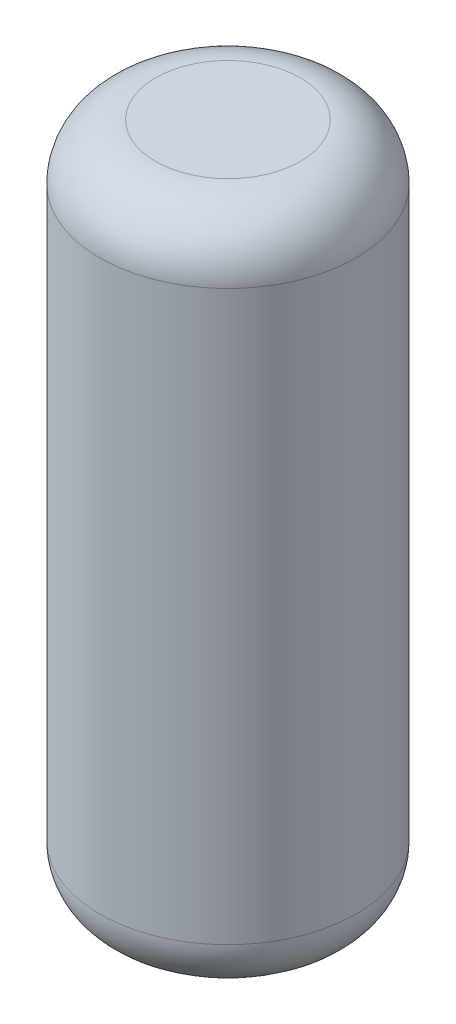
from build123d import *

# Parameters (mm, degrees)
SKETCH3_R           = 12.7
BOSS_EXTRUDE1_DEPTH = 19.05
SHELL1_T            = -2.54
BOSS_EXTRUDE2_START = -19.05
SKETCH6_R           = 12.7
BOSS_EXTRUDE2_DEPTH = 25.4
SKETCH7_R           = 7.9375
CUT_EXTRUDE3_DEPTH  = 25.4


with BuildPart() as part:
    # Sketch2 → Revolve1 (revolve)
    with BuildSketch(Plane.XY):
        with BuildLine():
            Line((0, -232.41), (49.53, -232.41))
            ThreePointArc((49.53, -232.41), (76.470768363, -221.250768363), (87.63, -194.31))
            Line((87.63, -194.31), (87.63, -156.21))
            Line((87.63, -156.21), (87.63, 156.21))
            Line((87.63, 156.21), (87.63, 194.31))
            ThreePointArc((87.63, 194.31), (76.470768363, 221.250768363), (49.53, 232.41))
            Line((49.53, 232.41), (0, 232.41))
            Line((0, 232.41), (0, -232.41))
        make_face()
    revolve(axis=Axis((0, -232.41, 0), (0, 1, 0)))

    # Sketch3 → Boss-Extrude1 (add)
    with BuildSketch(Plane(origin=(0, -232.41, 0), x_dir=(-1, 0, 0), z_dir=(0, -1, 0))):
        Circle(SKETCH3_R)
    extrude(amount=BOSS_EXTRUDE1_DEPTH)

    # Shell1
    shell1_openings = [part.faces().sort_by_distance(p)[0] for p in [
        (0, -251.46, 0),
    ]]
    offset(amount=SHELL1_T, openings=shell1_openings, kind=Kind.INTERSECTION)

    # Sketch6 → Boss-Extrude2 (add)
    with BuildSketch(Plane(origin=(0, -251.46, 0), x_dir=(-1, 0, 0), z_dir=(0, -1, 0)).offset(BOSS_EXTRUDE2_START)):
        Circle(SKETCH6_R)
    extrude(amount=BOSS_EXTRUDE2_DEPTH)

    # Sketch7 → Cut-Extrude3 (cut)
    with BuildSketch(Plane.XZ.offset(257.81)):
        Circle(SKETCH7_R)
    extrude(amount=-CUT_EXTRUDE3_DEPTH, mode=Mode.SUBTRACT)


solid = part.part
